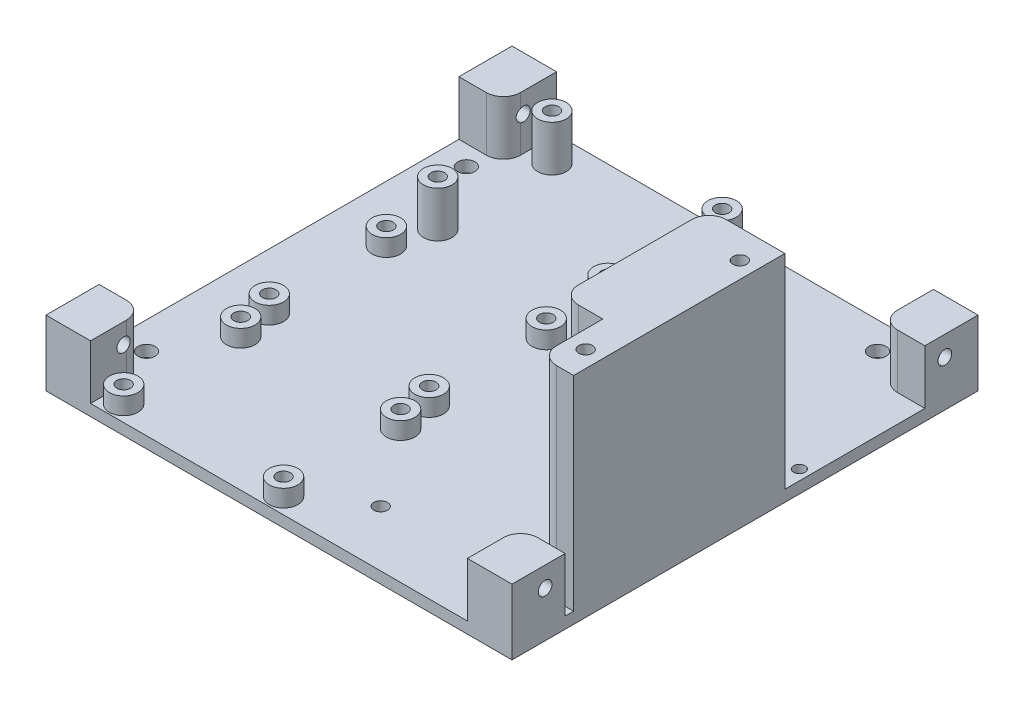
from build123d import *

# Parameters (mm, degrees)
SKETCH_1_W               = 82
SKETCH_1_H               = 82
EXTRUDE_1_DEPTH          = 2
CUT_EXTRUDE_2_DEPTH      = 81.215754284
CUT_EXTRUDE_2_DEPTH_BACK = 81.215754284
SKETCH_3_R               = 1.2
CUT_EXTRUDE_3_DEPTH      = 81.215754284
CUT_EXTRUDE_3_DEPTH_BACK = 81.215754284
SKETCH_3_3_R             = 1.2
SKETCH_3_3_R_2           = 1
EXTRUDE_START            = 35.75
SKETCH_4_R               = 1.2
EXTRUDE_2_DEPTH          = 35.75
CUT_EXTRUDE_4_REACH      = 89.799
SKETCH_5_R               = 1.5
SKETCH_7_W               = 8
SKETCH_7_H               = 9.5
EXTRUDE_3_DEPTH          = 9.5
SKETCH_8_R               = 1.2
CUT_EXTRUDE_5_DEPTH      = 112.749478265
CUT_EXTRUDE_6_DEPTH      = 88.798802585
CUT_EXTRUDE_6_DEPTH_BACK = 88.798802585
SKETCH_9_W               = 82
SKETCH_9_H               = 82
SKETCH_9_W_2             = 81.6
SKETCH_9_H_2             = 81.6
EXTRUDE_START_2          = 8
SKETCH_10_R              = 2.5
SKETCH_10_R_2            = 1.2
EXTRUDE_4_DEPTH          = 8
EXTRUDE_START_3          = 3
SKETCH_11_R              = 2.5
SKETCH_11_R_2            = 1.2
EXTRUDE_5_DEPTH          = 3
FILLET_1_R               = 3


with BuildPart() as part:
    # 草圖1 → 填料-伸長1 (new body)
    with BuildSketch(Plane(origin=(0, 0, 0), x_dir=(1, 0, 0), z_dir=(0, 1, 0))):
        with Locations((-4.734930226, -24.870201097)):
            Rectangle(SKETCH_1_W, SKETCH_1_H)
    extrude(amount=EXTRUDE_1_DEPTH)

    # 草圖3 → 除料-伸長2 (cut, two sides: drawn at the far end of the back side and taken through both)
    with BuildSketch(Plane(origin=(0, 2, 0), x_dir=(1, 0, 0), z_dir=(0, 1, 0)).offset(-CUT_EXTRUDE_2_DEPTH_BACK)):
        with Locations(Location((-33.734930226, 11.129798903, 0), (0, 0, 270))):
            Circle(SKETCH_3_R)
        with Locations(Location((-3.934930226, 11.129798903, 0), (0, 0, 270))):
            Circle(SKETCH_3_R)
        with Locations(Location((-33.734930226, -8.870201097, 0), (0, 0, 270))):
            Circle(SKETCH_3_R)
        with Locations(Location((-3.934930226, -8.870201097, 0), (0, 0, 270))):
            Circle(SKETCH_3_R)
    extrude(amount=CUT_EXTRUDE_2_DEPTH + CUT_EXTRUDE_2_DEPTH_BACK, mode=Mode.SUBTRACT)

    # 草圖3<3> → 除料-伸長3 (cut, two sides: drawn at the far end of the back side and taken through both)
    with BuildSketch(Plane(origin=(0, 2, 0), x_dir=(1, 0, 0), z_dir=(0, 1, 0)).offset(-CUT_EXTRUDE_3_DEPTH_BACK)):
        with Locations(Location((3.265069774, -55.870201097, 0), (0, 0, 270))):
            Circle(SKETCH_3_3_R)
        with Locations(Location((19.515069774, -25.670201097, 0), (0, 0, 270))):
            Circle(SKETCH_3_3_R)
        with Locations(Location((-33.734930226, 11.129798903, 0), (0, 0, 270))):
            Circle(SKETCH_3_3_R)
        with Locations(Location((-3.934930226, 11.129798903, 0), (0, 0, 270))):
            Circle(SKETCH_3_3_R)
        with Locations(Location((-33.734930226, -8.870201097, 0), (0, 0, 270))):
            Circle(SKETCH_3_3_R)
        with Locations(Location((-3.934930226, -8.870201097, 0), (0, 0, 270))):
            Circle(SKETCH_3_3_R)
        with Locations(Location((2.315069774, 2.629798903, 0), (0, 0, 270))):
            Circle(SKETCH_3_3_R_2)
        with Locations(Location((-7.734930226, -15.870201097, 0), (0, 0, 270))):
            Circle(SKETCH_3_3_R)
        with Locations(Location((-35.734930226, -15.870201097, 0), (0, 0, 270))):
            Circle(SKETCH_3_3_R)
        with Locations(Location((-7.734930226, -36.370201097, 0), (0, 0, 270))):
            Circle(SKETCH_3_3_R)
        with Locations(Location((-35.734930226, -36.370201097, 0), (0, 0, 270))):
            Circle(SKETCH_3_3_R)
        with Locations(Location((-6.734930226, -42.370201097, 0), (0, 0, 270))):
            Circle(SKETCH_3_3_R)
        with Locations(Location((-6.734930226, -62.870201097, 0), (0, 0, 270))):
            Circle(SKETCH_3_3_R)
        with Locations(Location((-34.734930226, -42.370201097, 0), (0, 0, 270))):
            Circle(SKETCH_3_3_R)
        with Locations(Location((-34.734930226, -62.870201097, 0), (0, 0, 270))):
            Circle(SKETCH_3_3_R)
        with Locations(Location((34.265069774, -13.560201097, 0), (0, 0, 270))):
            Circle(SKETCH_3_3_R_2)
        with Locations(Location((33.165069774, -22.878161185, 0), (0, 0, 270))):
            Circle(SKETCH_3_3_R)
        with Locations(Location((33.165069774, -49.878161185, 0), (0, 0, 270))):
            Circle(SKETCH_3_3_R)
    extrude(amount=CUT_EXTRUDE_3_DEPTH + CUT_EXTRUDE_3_DEPTH_BACK, mode=Mode.SUBTRACT)

    # 草圖4 → 填料-伸長2 (add)
    with BuildSketch(Plane(origin=(0, 2, 0), x_dir=(1, 0, 0), z_dir=(0, 1, 0)).offset(EXTRUDE_START)):
        Polygon((36.265069774, -17.878161185), (22.765069774, -17.878161185), (22.765069774, -43.759782879), (30.065069774, -43.759782879), (30.065069774, -54.878161185), (36.265069774, -54.878161185), align=None)
        with Locations(Location((33.165069774, -22.878161185, 0), (0, 0, 270))):
            Circle(SKETCH_4_R, mode=Mode.SUBTRACT)
        with Locations(Location((33.165069774, -49.878161185, 0), (0, 0, 270))):
            Circle(SKETCH_4_R, mode=Mode.SUBTRACT)
    extrude(amount=-EXTRUDE_2_DEPTH)

    # 草圖5 → 除料-伸長4 (cut, up to next)
    with BuildSketch(Plane(origin=(0, 2, 0), x_dir=(1, 0, 0), z_dir=(0, 1, 0)), mode=Mode.PRIVATE) as cut_extrude_4_sk1:
        with Locations(Location((26.765069774, -49.870201097, 0), (0, 0, 270))):
            Circle(SKETCH_5_R)
    cut_extrude_4_tool1 = extrude(cut_extrude_4_sk1.sketch, amount=-CUT_EXTRUDE_4_REACH, mode=Mode.PRIVATE) & part.part
    # 草圖5 → 除料-伸長4 (cut, up to next)
    with BuildSketch(Plane(origin=(0, 2, 0), x_dir=(1, 0, 0), z_dir=(0, 1, 0)), mode=Mode.PRIVATE) as cut_extrude_4_sk2:
        with Locations(Location((23.265069774, 11.129798903, 0), (0, 0, 270))):
            Circle(SKETCH_5_R)
    cut_extrude_4_tool2 = extrude(cut_extrude_4_sk2.sketch, amount=-CUT_EXTRUDE_4_REACH, mode=Mode.PRIVATE) & part.part
    # 草圖5 → 除料-伸長4 (cut, up to next)
    with BuildSketch(Plane(origin=(0, 2, 0), x_dir=(1, 0, 0), z_dir=(0, 1, 0)), mode=Mode.PRIVATE) as cut_extrude_4_sk3:
        with Locations(Location((-40.734930226, 3.129798903, 0), (0, 0, 270))):
            Circle(SKETCH_5_R)
    cut_extrude_4_tool3 = extrude(cut_extrude_4_sk3.sketch, amount=-CUT_EXTRUDE_4_REACH, mode=Mode.PRIVATE) & part.part
    # 草圖5 → 除料-伸長4 (cut, up to next)
    with BuildSketch(Plane(origin=(0, 2, 0), x_dir=(1, 0, 0), z_dir=(0, 1, 0)), mode=Mode.PRIVATE) as cut_extrude_4_sk4:
        with Locations(Location((-40.734930226, -52.870201097, 0), (0, 0, 270))):
            Circle(SKETCH_5_R)
    cut_extrude_4_tool4 = extrude(cut_extrude_4_sk4.sketch, amount=-CUT_EXTRUDE_4_REACH, mode=Mode.PRIVATE) & part.part
    add(cut_extrude_4_tool1.solids().sort_by_distance((26.76507, 2, 49.870201))[0], mode=Mode.SUBTRACT)
    add(cut_extrude_4_tool2.solids().sort_by_distance((23.26507, 2, -11.129799))[0], mode=Mode.SUBTRACT)
    add(cut_extrude_4_tool3.solids().sort_by_distance((-40.73493, 2, -3.129799))[0], mode=Mode.SUBTRACT)
    add(cut_extrude_4_tool4.solids().sort_by_distance((-40.73493, 2, 52.870201))[0], mode=Mode.SUBTRACT)

    # 草圖7 → 填料-伸長3 (add)
    with BuildSketch(Plane(origin=(0, 2, 0), x_dir=(1, 0, 0), z_dir=(0, 1, 0))):
        with Locations((-41.734930226, 11.379798903)):
            Rectangle(SKETCH_7_W, SKETCH_7_H)
        with Locations((32.265069774, 11.379798903)):
            Rectangle(SKETCH_7_W, SKETCH_7_H)
        with Locations((32.265069774, -61.120201097)):
            Rectangle(SKETCH_7_W, SKETCH_7_H)
        with Locations((-41.734930226, -61.120201097)):
            Rectangle(SKETCH_7_W, SKETCH_7_H)
    extrude(amount=EXTRUDE_3_DEPTH)

    # 草圖8 → 除料-伸長5 (cut, through all)
    with BuildSketch(Plane(origin=(36.265069774, 0, 0), x_dir=(0, 0, -1), z_dir=(1, 0, 0))):
        with Locations((-59.870201097, 8)):
            Circle(SKETCH_8_R)
        with Locations((10.129798903, 8)):
            Circle(SKETCH_8_R)
    extrude(amount=-CUT_EXTRUDE_5_DEPTH, mode=Mode.SUBTRACT)

    # 草圖9 → 除料-伸長6 (cut, two sides: drawn at the far end of the back side and taken through both)
    with BuildSketch(Plane(origin=(0, 2, 0), x_dir=(1, 0, 0), z_dir=(0, 1, 0)).offset(-CUT_EXTRUDE_6_DEPTH_BACK)):
        with Locations((-4.734930226, -24.870201097)):
            Rectangle(SKETCH_9_W, SKETCH_9_H)
        with Locations((-4.734930226, -24.870201097)):
            Rectangle(SKETCH_9_W_2, SKETCH_9_H_2, mode=Mode.SUBTRACT)
    extrude(amount=CUT_EXTRUDE_6_DEPTH + CUT_EXTRUDE_6_DEPTH_BACK, mode=Mode.SUBTRACT)

    # 草圖10 → 填料-伸長4 (add)
    # profile 1 of 4: a face of its own
    with BuildSketch(Plane(origin=(0, 2, 0), x_dir=(1, 0, 0), z_dir=(0, 1, 0)).offset(EXTRUDE_START_2)):
        with Locations(Location((-33.734930226, 11.129798903, 0), (0, 0, 270))):
            Circle(SKETCH_10_R)
        with Locations(Location((-33.734930226, 11.129798903, 0), (0, 0, 270))):
            Circle(SKETCH_10_R_2, mode=Mode.SUBTRACT)
    # profile 2 of 4: a face of its own
    with BuildSketch(Plane(origin=(0, 2, 0), x_dir=(1, 0, 0), z_dir=(0, 1, 0)).offset(EXTRUDE_START_2)):
        with Locations(Location((-3.934930226, 11.129798903, 0), (0, 0, 270))):
            Circle(SKETCH_10_R)
        with Locations(Location((-3.934930226, 11.129798903, 0), (0, 0, 270))):
            Circle(SKETCH_10_R_2, mode=Mode.SUBTRACT)
    # profile 3 of 4: a face of its own
    with BuildSketch(Plane(origin=(0, 2, 0), x_dir=(1, 0, 0), z_dir=(0, 1, 0)).offset(EXTRUDE_START_2)):
        with Locations(Location((-33.734930226, -8.870201097, 0), (0, 0, 270))):
            Circle(SKETCH_10_R)
        with Locations(Location((-33.734930226, -8.870201097, 0), (0, 0, 270))):
            Circle(SKETCH_10_R_2, mode=Mode.SUBTRACT)
    # profile 4 of 4: a face of its own
    with BuildSketch(Plane(origin=(0, 2, 0), x_dir=(1, 0, 0), z_dir=(0, 1, 0)).offset(EXTRUDE_START_2)):
        with Locations(Location((-3.934930226, -8.870201097, 0), (0, 0, 270))):
            Circle(SKETCH_10_R)
        with Locations(Location((-3.934930226, -8.870201097, 0), (0, 0, 270))):
            Circle(SKETCH_10_R_2, mode=Mode.SUBTRACT)
    extrude(amount=-EXTRUDE_4_DEPTH)

    # 草圖11 → 填料-伸長5 (add)
    # profile 1 of 8: a face of its own
    with BuildSketch(Plane(origin=(0, 2, 0), x_dir=(1, 0, 0), z_dir=(0, 1, 0)).offset(EXTRUDE_START_3)):
        with Locations(Location((-35.734930226, -15.870201097, 0), (0, 0, 270))):
            Circle(SKETCH_11_R)
        with Locations(Location((-35.734930226, -15.870201097, 0), (0, 0, 270))):
            Circle(SKETCH_11_R_2, mode=Mode.SUBTRACT)
    # profile 2 of 8: a face of its own
    with BuildSketch(Plane(origin=(0, 2, 0), x_dir=(1, 0, 0), z_dir=(0, 1, 0)).offset(EXTRUDE_START_3)):
        with Locations(Location((-7.734930226, -15.870201097, 0), (0, 0, 270))):
            Circle(SKETCH_11_R)
        with Locations(Location((-7.734930226, -15.870201097, 0), (0, 0, 270))):
            Circle(SKETCH_11_R_2, mode=Mode.SUBTRACT)
    # profile 3 of 8: a face of its own
    with BuildSketch(Plane(origin=(0, 2, 0), x_dir=(1, 0, 0), z_dir=(0, 1, 0)).offset(EXTRUDE_START_3)):
        with Locations(Location((-35.734930226, -36.370201097, 0), (0, 0, 270))):
            Circle(SKETCH_11_R)
        with Locations(Location((-35.734930226, -36.370201097, 0), (0, 0, 270))):
            Circle(SKETCH_11_R_2, mode=Mode.SUBTRACT)
    # profile 4 of 8: a face of its own
    with BuildSketch(Plane(origin=(0, 2, 0), x_dir=(1, 0, 0), z_dir=(0, 1, 0)).offset(EXTRUDE_START_3)):
        with Locations(Location((-7.734930226, -36.370201097, 0), (0, 0, 270))):
            Circle(SKETCH_11_R)
        with Locations(Location((-7.734930226, -36.370201097, 0), (0, 0, 270))):
            Circle(SKETCH_11_R_2, mode=Mode.SUBTRACT)
    # profile 5 of 8: a face of its own
    with BuildSketch(Plane(origin=(0, 2, 0), x_dir=(1, 0, 0), z_dir=(0, 1, 0)).offset(EXTRUDE_START_3)):
        with Locations(Location((-34.734930226, -42.370201097, 0), (0, 0, 270))):
            Circle(SKETCH_11_R)
        with Locations(Location((-34.734930226, -42.370201097, 0), (0, 0, 270))):
            Circle(SKETCH_11_R_2, mode=Mode.SUBTRACT)
    # profile 6 of 8: a face of its own
    with BuildSketch(Plane(origin=(0, 2, 0), x_dir=(1, 0, 0), z_dir=(0, 1, 0)).offset(EXTRUDE_START_3)):
        with Locations(Location((-6.734930226, -42.370201097, 0), (0, 0, 270))):
            Circle(SKETCH_11_R)
        with Locations(Location((-6.734930226, -42.370201097, 0), (0, 0, 270))):
            Circle(SKETCH_11_R_2, mode=Mode.SUBTRACT)
    # profile 7 of 8: a face of its own
    with BuildSketch(Plane(origin=(0, 2, 0), x_dir=(1, 0, 0), z_dir=(0, 1, 0)).offset(EXTRUDE_START_3)):
        with Locations(Location((-34.734930226, -62.870201097, 0), (0, 0, 270))):
            Circle(SKETCH_11_R)
        with Locations(Location((-34.734930226, -62.870201097, 0), (0, 0, 270))):
            Circle(SKETCH_11_R_2, mode=Mode.SUBTRACT)
    # profile 8 of 8: a face of its own
    with BuildSketch(Plane(origin=(0, 2, 0), x_dir=(1, 0, 0), z_dir=(0, 1, 0)).offset(EXTRUDE_START_3)):
        with Locations(Location((-6.734930226, -62.870201097, 0), (0, 0, 270))):
            Circle(SKETCH_11_R)
        with Locations(Location((-6.734930226, -62.870201097, 0), (0, 0, 270))):
            Circle(SKETCH_11_R_2, mode=Mode.SUBTRACT)
    extrude(amount=-EXTRUDE_5_DEPTH)

    # 圓角1
    # the kernel refuses this fillet: 3 mm, written as the material it takes off along each edge
    with BuildSketch(Plane(origin=(22.765069774, 45.25, 17.878161185), x_dir=(1, 0, 0), z_dir=(0, -1, 0)), Plane(origin=(22.765069774, 45.25, 43.759782879), x_dir=(0, 0, -1), z_dir=(0, -1, 0)), Plane(origin=(30.065069774, 45.25, 54.878161185), x_dir=(0, 0, -1), z_dir=(0, -1, 0))) as fillet_1_piece_1:
        with BuildLine():
            CenterArc((FILLET_1_R, FILLET_1_R), FILLET_1_R, 180, 90)
            Line((0, FILLET_1_R), (0, 0))
            Line((0, 0), (FILLET_1_R, 0))
        make_face()
    extrude(amount=43.25, mode=Mode.SUBTRACT)
    with BuildSketch(Plane(origin=(-37.734930226, 2, -6.629798903), x_dir=(0, 0, -1), z_dir=(0, 1, 0)), Plane(origin=(28.265069774, 2, -6.629798903), x_dir=(1, 0, 0), z_dir=(0, 1, 0)), Plane(origin=(-37.734930226, 2, 56.370201097), x_dir=(-1, 0, 0), z_dir=(0, 1, 0))) as fillet_1_piece_2:
        with BuildLine():
            CenterArc((FILLET_1_R, FILLET_1_R), FILLET_1_R, 180, 90)
            Line((0, FILLET_1_R), (0, 0))
            Line((0, 0), (FILLET_1_R, 0))
        make_face()
    extrude(amount=17, mode=Mode.SUBTRACT)
    with BuildSketch(Plane(origin=(28.265069774, 2, 56.370201097), x_dir=(1, 0, 0), z_dir=(0, 1, 0))) as fillet_1_piece_3:
        with BuildLine():
            CenterArc((FILLET_1_R, -FILLET_1_R), FILLET_1_R, 90, 90)
            Line((0, -FILLET_1_R), (0, 0))
            Line((0, 0), (FILLET_1_R, 0))
        make_face()
    extrude(amount=17, mode=Mode.SUBTRACT)


solid = part.part
